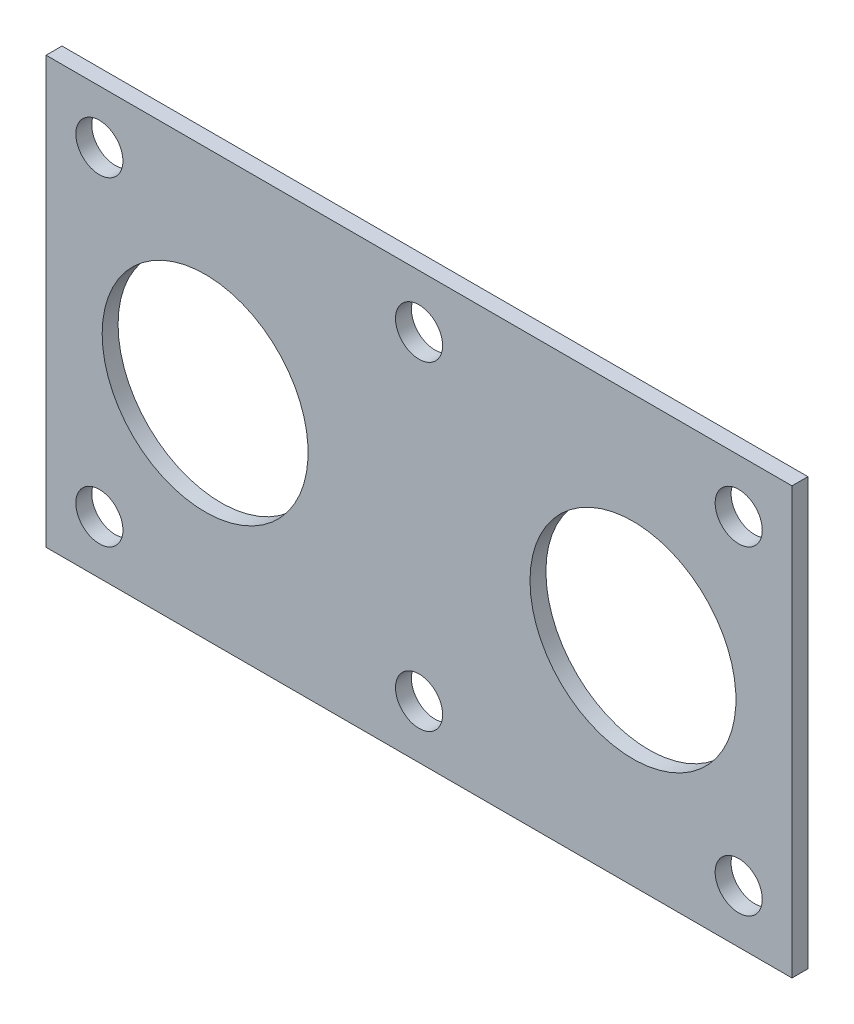
from build123d import *

# Parameters (mm, degrees)
SKETCH1_W              = 88.9
SKETCH1_H              = 50.8
SKETCH1_R              = 12.272596154
BOSS_EXTRUDE1_DEPTH    = 1.89738
F_10_CLEARANCE_HOLE1_D = 5.6134


with BuildPart() as part:
    # Sketch1 → Boss-Extrude1 (new body)
    with BuildSketch(Plane.XY):
        with Locations((25.49525, 0)):
            Rectangle(SKETCH1_W, SKETCH1_H)
        Circle(SKETCH1_R, mode=Mode.SUBTRACT)
        with Locations((50.9905, 0)):
            Circle(SKETCH1_R, mode=Mode.SUBTRACT)
    extrude(amount=BOSS_EXTRUDE1_DEPTH)

    # #10 Clearance Hole1 (through all)
    with Locations(Plane(origin=(-41.275, -44.45, 1.89738), x_dir=(1, 0, 0), z_dir=(0, 0, 1))):
        with Locations((104.87025, 63.5), (28.67025, 63.5), (66.77025, 25.4), (28.67025, 25.4), (66.77025, 63.5), (104.87025, 25.4)):
            Hole(F_10_CLEARANCE_HOLE1_D / 2)


solid = part.part
